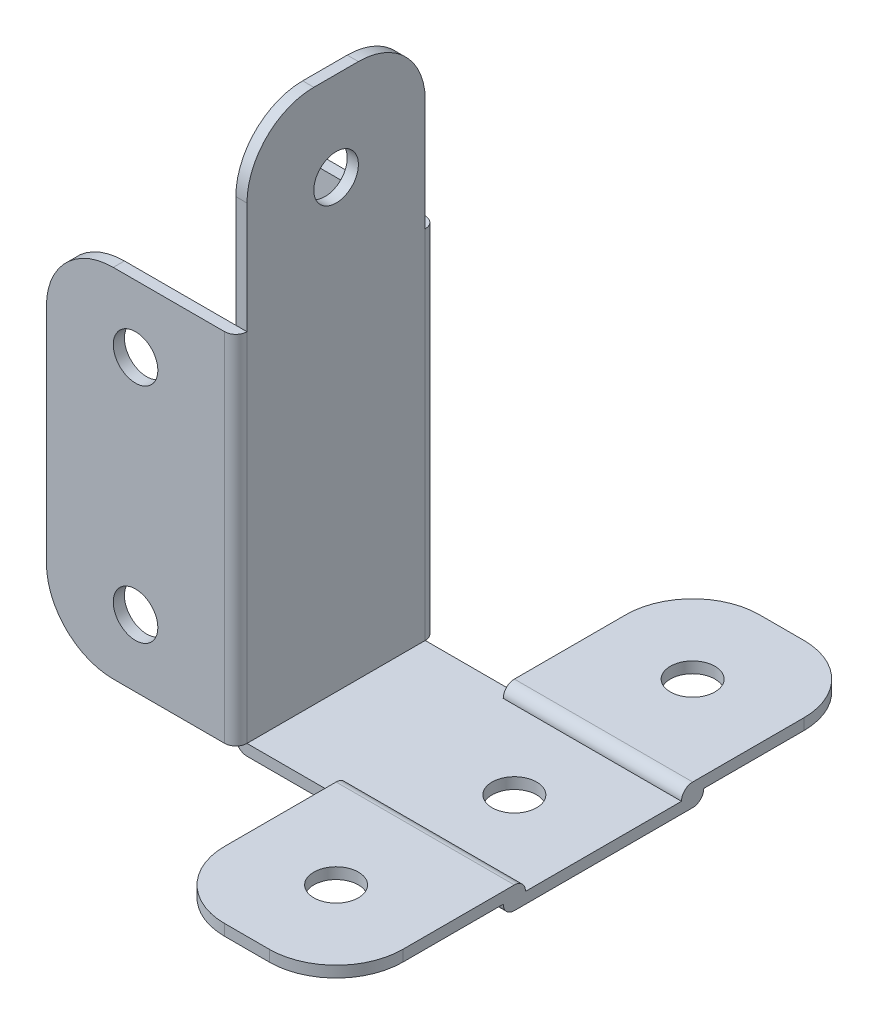
from build123d import *

# Parameters (mm, degrees)
SKETCH1_W             = 25.4
SKETCH1_H             = 50.8
SKETCH1_R             = 3.175
BOSS_EXTRUDE1_DEPTH   = 1.5875
BOSS_EXTRUDE2_START   = -25.4
SKETCH1_2_W           = 25.4
SKETCH1_2_H           = 50.8
SKETCH1_2_R           = 3.175
BOSS_EXTRUDE2_DEPTH   = 1.5875
SKETCH3_R             = 3.175
BOSS_EXTRUDE3_DEPTH   = 1.5875
SKETCH4_W             = 38.1
SKETCH4_H             = 25.4
SKETCH4_R             = 3.175
BOSS_EXTRUDE4_DEPTH   = 1.5875
SKETCH6_W             = 1.5875
SKETCH6_H             = 50.8
REVOLVE1_ANGLE        = 90
SKETCH7_W             = 1.5875
SKETCH7_H             = 50.8
REVOLVE2_ANGLE        = 90
SKETCH8_W             = 25.4
SKETCH8_H             = 1.5875
REVOLVE3_ANGLE        = 90
SKETCH9_W             = 25.4
SKETCH9_H             = 25.4
SKETCH9_R             = 3.175
BOSS_EXTRUDE5_DEPTH   = 1.5875
BOSS_EXTRUDE5_2_DEPTH = 1.5875
SKETCH12_W            = 25.4
SKETCH12_H            = 1.5875
SKETCH13_W            = 25.4
SKETCH13_H            = 1.5875
FILLET6_R             = 9.525


with BuildPart() as part:
    # Sketch1 → Boss-Extrude1 (new body)
    with BuildSketch(Plane.XY):
        with Locations((-12.7, 25.4)):
            Rectangle(SKETCH1_W, SKETCH1_H)
        with Locations((-12.7, 41.275)):
            Circle(SKETCH1_R, mode=Mode.SUBTRACT)
        with Locations((-12.7, 9.525)):
            Circle(SKETCH1_R, mode=Mode.SUBTRACT)
    extrude(amount=BOSS_EXTRUDE1_DEPTH)



with BuildPart() as body_2:
    # Sketch1<2> → Boss-Extrude2 (new body)
    with BuildSketch(Plane.XY.offset(BOSS_EXTRUDE2_START)):
        with Locations((-12.7, 25.4)):
            Rectangle(SKETCH1_2_W, SKETCH1_2_H)
        with Locations((-12.7, 41.275)):
            Circle(SKETCH1_2_R, mode=Mode.SUBTRACT)
        with Locations((-12.7, 9.525)):
            Circle(SKETCH1_2_R, mode=Mode.SUBTRACT)
    extrude(amount=-BOSS_EXTRUDE2_DEPTH)



with BuildPart() as body_3:
    # Sketch3 → Boss-Extrude3 (new body)
    with BuildSketch(Plane(origin=(0, 0, 0), x_dir=(0, 0, -1), z_dir=(1, 0, 0))):
        Polygon((25.4, 50.8), (25.4, 0), (0, 0), (0, 50.8), (0, 76.2), (25.4, 76.2), align=None)
        with Locations((12.7, 63.5)):
            Circle(SKETCH3_R, mode=Mode.SUBTRACT)
    extrude(amount=BOSS_EXTRUDE3_DEPTH)


with BuildPart() as body_4:
    # Sketch4 → Boss-Extrude4 (new body)
    with BuildSketch(Plane(origin=(0, 0, 0), x_dir=(1, 0, 0), z_dir=(0, 1, 0))):
        with Locations((20.6375, 12.7)):
            Rectangle(SKETCH4_W, SKETCH4_H)
        with Locations((26.9875, 12.7)):
            Circle(SKETCH4_R, mode=Mode.SUBTRACT)
    extrude(amount=-BOSS_EXTRUDE4_DEPTH)


with BuildPart() as part_1:
    add(part.part)

    add(body_3.part)  # Revolve1 merges body 3
    # Sketch6 → Revolve1 (revolve)
    with BuildSketch(Plane(origin=(0, 0, 0), x_dir=(0, 0, -1), z_dir=(1, 0, 0))):
        with Locations((-0.79375, 25.4)):
            Rectangle(SKETCH6_W, SKETCH6_H)
    revolve(axis=Axis((0, 0, 0), (0, 1, 0)), revolution_arc=REVOLVE1_ANGLE)


with BuildPart() as body_2_1:
    add(body_2.part)

    add(part_1.part)  # Revolve2 merges part
    # Sketch7 → Revolve2 (revolve)
    with BuildSketch(Plane(origin=(0, 0, 0), x_dir=(0, 0, -1), z_dir=(1, 0, 0))):
        with Locations((26.19375, 25.4)):
            Rectangle(SKETCH7_W, SKETCH7_H)
    revolve(axis=Axis((0, 50.8, -25.4), (0, -1, 0)), revolution_arc=REVOLVE2_ANGLE)


    add(body_4.part)  # Revolve3 merges body 4
    # Sketch8 → Revolve3 (revolve)
    with BuildSketch(Plane.ZY.offset(-1.5875)):
        with Locations((-12.7, -0.79375)):
            Rectangle(SKETCH8_W, SKETCH8_H)
    revolve(axis=Axis((1.5875, 0, 0), (0, 0, -1)), revolution_arc=REVOLVE3_ANGLE)



with BuildPart() as body_2_2:
    # Sketch9 → Boss-Extrude5 (new body)
    with BuildSketch(Plane(origin=(0, 0, 0), x_dir=(1, 0, 0), z_dir=(0, 1, 0))):
        with Locations((26.9875, 38.1)):
            Rectangle(SKETCH9_W, SKETCH9_H)
        with Locations((26.9875, 38.1)):
            Circle(SKETCH9_R, mode=Mode.SUBTRACT)
    extrude(amount=BOSS_EXTRUDE5_DEPTH)


with BuildPart() as body_3_2:
    # Sketch9 → Boss-Extrude5 2 (new body)
    with BuildSketch(Plane(origin=(0, 0, 0), x_dir=(1, 0, 0), z_dir=(0, 1, 0))):
        with Locations((26.9875, -12.7)):
            Rectangle(SKETCH9_W, SKETCH9_H)
        with Locations((26.9875, -12.7)):
            Circle(SKETCH9_R, mode=Mode.SUBTRACT)
    extrude(amount=BOSS_EXTRUDE5_2_DEPTH)


with BuildPart() as body_2_3:
    add(body_2_1.part)

    add(body_2_2.part)  # Revolve6 merges body 2 2
    # Sketch12 → Revolve6 (revolve)
    with BuildSketch(Plane.XY.offset(-25.4)):
        with Locations((26.9875, 0.79375)):
            Rectangle(SKETCH12_W, SKETCH12_H)
    revolve(axis=Axis((14.2875, 0, -25.4), (1, 0, 0)))


    add(body_3_2.part)  # Revolve7 merges body 3 2
    # Sketch13 → Revolve7 (revolve)
    with BuildSketch(Plane(origin=(0, 0, 0), x_dir=(-1, 0, 0), z_dir=(0, 0, -1))):
        with Locations((-26.9875, 0.79375)):
            Rectangle(SKETCH13_W, SKETCH13_H)
    revolve(axis=Axis((39.6875, 0, 0), (-1, 0, 0)))

    # Fillet6
    fillet6_edges = [body_2_3.edges().sort_by_distance(p)[0] for p in [
        (14.2875, 0.79375, -50.8),
        (39.6875, 0.79375, -50.8),
        (14.2875, 0.79375, 25.4),
        (39.6875, 0.79375, 25.4),
        (-25.4, 0, 0.79375),
        (-25.4, 0, -26.19375),
        (-25.4, 50.8, 0.79375),
        (-25.4, 50.8, -26.19375),
        (0.79375, 76.2, 0),
        (0.79375, 76.2, -25.4),
    ]]
    fillet(fillet6_edges, radius=FILLET6_R)


solid = body_2_3.part
